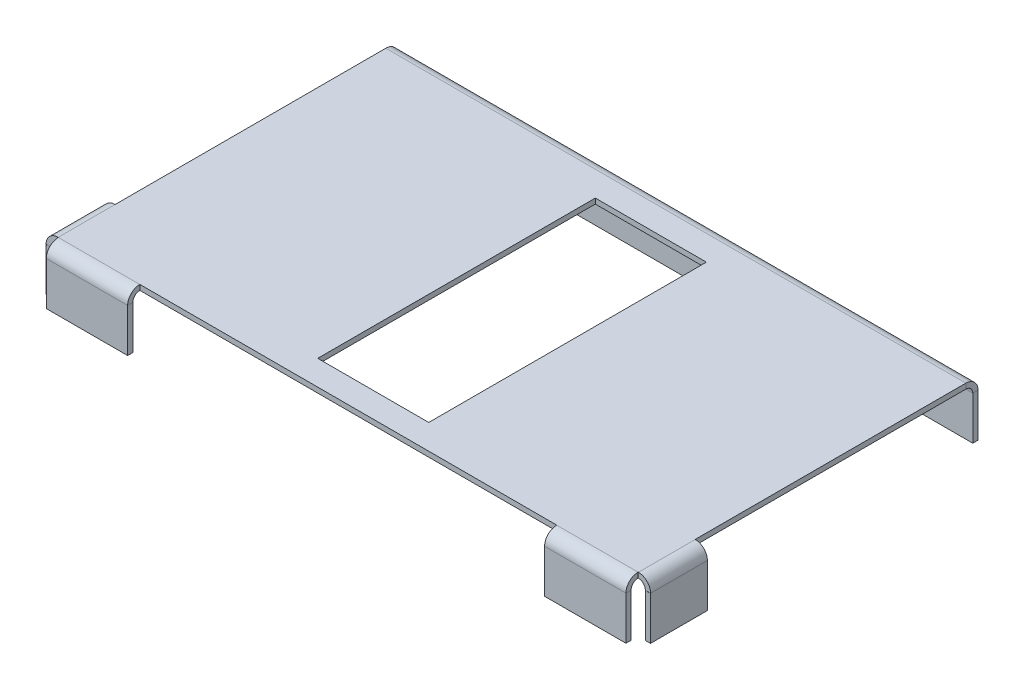
from build123d import *

# Parameters (mm, degrees)
SKETCH1_W                    = 271.78
SKETCH1_H                    = 156.21
BASE_FLANGE1_DEPTH           = 2.38125
EDGE_FLANGE1_STRIP_W         = 15.875
EDGE_FLANGE1_STRIP_H         = 2.38125
EDGE_FLANGE1_STRIP_CUT_DEPTH = 271.78
EDGE_FLANGE1_DEPTH           = 271.78
EDGE_FLANGE2_STRIP_W         = 15.875
EDGE_FLANGE2_STRIP_H         = 2.38125
EDGE_FLANGE2_STRIP_CUT_DEPTH = 153.035
EDGE_FLANGE2_DEPTH           = 153.035
SKETCH14_W                   = 127
SKETCH14_H                   = 30.097595223
CUT_EXTRUDE1_DEPTH           = 5.588
EDGE_FLANGE3_STRIP_W         = 15.875
EDGE_FLANGE3_STRIP_H         = 2.38125
EDGE_FLANGE3_STRIP_CUT_DEPTH = 153.035
EDGE_FLANGE3_DEPTH           = 153.035
SKETCH18_W                   = 127
SKETCH18_H                   = 45.504454023
CUT_EXTRUDE2_DEPTH           = 5.588
CUT_EXTRUDE3_START           = -3.302
CUT_EXTRUDE3_DEPTH           = 5.68325
CUT_EXTRUDE4_START           = -3.302
CUT_EXTRUDE4_DEPTH           = 5.68325
EDGE_FLANGE4_STRIP_W         = 15.875
EDGE_FLANGE4_STRIP_H         = 2.38125
EDGE_FLANGE4_STRIP_CUT_DEPTH = 265.3665
EDGE_FLANGE4_DEPTH           = 265.3665
SKETCH24_W                   = 190.754
SKETCH24_H                   = 70.532416994
CUT_EXTRUDE5_DEPTH           = 5.588
SKETCH25_W                   = 50.8
SKETCH25_H                   = 127
CUT_EXTRUDE6_DEPTH           = 2.54


# Read off the part's stored shape, not the designer's step: Cut-Extrude3, Cut-Extrude4
# Sheet-metal steps are written as plain solids
with BuildPart() as part:
    # Sketch1 → Base-Flange1 (new body)
    with BuildSketch(Plane(origin=(0, 0, 0), x_dir=(1, 0, 0), z_dir=(0, 1, 0))):
        Rectangle(SKETCH1_W, SKETCH1_H)
    extrude(amount=-BASE_FLANGE1_DEPTH)

    # Edge-Flange1 strip (across the edge) → Edge-Flange1 strip cut (cut)
    with BuildSketch(Plane(origin=(135.89, -2.38125, 78.105), x_dir=(0, 0, -1), z_dir=(-1, 0, 0))):
        with Locations((-4.7625, -1.190625)):
            Rectangle(EDGE_FLANGE1_STRIP_W, EDGE_FLANGE1_STRIP_H)
    extrude(amount=EDGE_FLANGE1_STRIP_CUT_DEPTH, mode=Mode.SUBTRACT)

    # Edge-Flange1 section (across the edge) → Edge-Flange1 (add)
    with BuildSketch(Plane(origin=(135.89, -2.38125, 78.105), x_dir=(0, 0, -1), z_dir=(-1, 0, 0))):
        with BuildLine():
            Line((-2.38125, 3.175), (-2.38125, 23.01875))
            Line((-2.38125, 23.01875), (0, 23.01875))
            Line((0, 23.01875), (0, 3.175))
            ThreePointArc((0, 3.175), (0.92993597, 0.92993597), (3.175, 0))
            Line((3.175, 0), (3.175, -2.38125))
            ThreePointArc((3.175, -2.38125), (-0.753862053, -0.753862053), (-2.38125, 3.175))
        make_face()
    extrude(amount=EDGE_FLANGE1_DEPTH)

    # Edge-Flange2 strip (across the edge) → Edge-Flange2 strip cut (cut)
    with BuildSketch(Plane(origin=(135.89, -2.38125, -78.105), x_dir=(-1, 0, 0), z_dir=(0, 0, 1))):
        with Locations((-4.7625, -1.190625)):
            Rectangle(EDGE_FLANGE2_STRIP_W, EDGE_FLANGE2_STRIP_H)
    extrude(amount=EDGE_FLANGE2_STRIP_CUT_DEPTH, mode=Mode.SUBTRACT)

    # Edge-Flange2 section (across the edge) → Edge-Flange2 (add)
    with BuildSketch(Plane(origin=(135.89, -2.38125, -78.105), x_dir=(-1, 0, 0), z_dir=(0, 0, 1))):
        with BuildLine():
            Line((-2.38125, 3.175), (-2.38125, 23.01875))
            Line((-2.38125, 23.01875), (0, 23.01875))
            Line((0, 23.01875), (0, 3.175))
            ThreePointArc((0, 3.175), (0.92993597, 0.92993597), (3.175, 0))
            Line((3.175, 0), (3.175, -2.38125))
            ThreePointArc((3.175, -2.38125), (-0.753862053, -0.753862053), (-2.38125, 3.175))
        make_face()
    extrude(amount=EDGE_FLANGE2_DEPTH)

    # Sketch14 → Cut-Extrude1 (cut)
    with BuildSketch(Plane(origin=(138.27125, 0, 0), x_dir=(0, 0, -1), z_dir=(1, 0, 0))):
        with Locations((14.605, -10.351202389)):
            Rectangle(SKETCH14_W, SKETCH14_H)
    extrude(amount=-CUT_EXTRUDE1_DEPTH, mode=Mode.SUBTRACT)

    # Edge-Flange3 strip (across the edge) → Edge-Flange3 strip cut (cut)
    with BuildSketch(Plane(origin=(-135.89, -2.38125, 74.93), x_dir=(1, 0, 0), z_dir=(0, 0, -1))):
        with Locations((-4.7625, -1.190625)):
            Rectangle(EDGE_FLANGE3_STRIP_W, EDGE_FLANGE3_STRIP_H)
    extrude(amount=EDGE_FLANGE3_STRIP_CUT_DEPTH, mode=Mode.SUBTRACT)

    # Edge-Flange3 section (across the edge) → Edge-Flange3 (add)
    with BuildSketch(Plane(origin=(-135.89, -2.38125, 74.93), x_dir=(1, 0, 0), z_dir=(0, 0, -1))):
        with BuildLine():
            Line((-2.38125, 3.175), (-2.38125, 23.01875))
            Line((-2.38125, 23.01875), (0, 23.01875))
            Line((0, 23.01875), (0, 3.175))
            ThreePointArc((0, 3.175), (0.92993597, 0.92993597), (3.175, 0))
            Line((3.175, 0), (3.175, -2.38125))
            ThreePointArc((3.175, -2.38125), (-0.753862053, -0.753862053), (-2.38125, 3.175))
        make_face()
    extrude(amount=EDGE_FLANGE3_DEPTH)

    # Sketch18 → Cut-Extrude2 (cut)
    with BuildSketch(Plane.ZY.offset(138.27125)):
        with Locations((-14.605, -2.647772988)):
            Rectangle(SKETCH18_W, SKETCH18_H)
    extrude(amount=-CUT_EXTRUDE2_DEPTH, mode=Mode.SUBTRACT)

    # Cut-Extrude3 outline → Cut-Extrude3 (cut)
    with BuildSketch(Plane.ZY.offset(135.89).offset(CUT_EXTRUDE3_START)):
        with BuildLine():
            Line((74.93, 0), (74.89825, 0))
            Line((74.89825, 0), (74.89825, -5.55625))
            Line((74.89825, -5.55625), (74.93, -5.55625))
            Line((74.93, -5.55625), (74.93, -2.38125))
            ThreePointArc((74.93, -2.38125), (77.17506403, -3.31118597), (78.105, -5.55625))
            Line((78.105, -5.55625), (78.105, -25.4))
            Line((78.105, -25.4), (80.48625, -25.4))
            Line((80.48625, -25.4), (80.48625, -5.55625))
            ThreePointArc((80.48625, -5.55625), (78.858862053, -1.627387947), (74.93, 0))
        make_face()
    extrude(amount=CUT_EXTRUDE3_DEPTH, mode=Mode.SUBTRACT)

    # Cut-Extrude4 outline → Cut-Extrude4 (cut)
    with BuildSketch(Plane(origin=(135.89, 0, 0), x_dir=(0, 0, -1), z_dir=(1, 0, 0)).offset(CUT_EXTRUDE4_START)):
        with BuildLine():
            Line((-74.89825, 0), (-74.93, 0))
            ThreePointArc((-74.93, 0), (-78.858862053, -1.627387947), (-80.48625, -5.55625))
            Line((-80.48625, -5.55625), (-80.48625, -25.4))
            Line((-80.48625, -25.4), (-78.105, -25.4))
            Line((-78.105, -25.4), (-78.105, -5.55625))
            ThreePointArc((-78.105, -5.55625), (-77.17506403, -3.31118597), (-74.93, -2.38125))
            Line((-74.93, -2.38125), (-74.93, -5.55625))
            Line((-74.93, -5.55625), (-74.89825, -5.55625))
            Line((-74.89825, -5.55625), (-74.89825, 0))
        make_face()
    extrude(amount=CUT_EXTRUDE4_DEPTH, mode=Mode.SUBTRACT)

    # Edge-Flange4 strip (across the edge) → Edge-Flange4 strip cut (cut)
    with BuildSketch(Plane(origin=(-132.68325, -2.38125, -78.105), x_dir=(0, 0, 1), z_dir=(1, 0, 0))):
        with Locations((-4.7625, -1.190625)):
            Rectangle(EDGE_FLANGE4_STRIP_W, EDGE_FLANGE4_STRIP_H)
    extrude(amount=EDGE_FLANGE4_STRIP_CUT_DEPTH, mode=Mode.SUBTRACT)

    # Edge-Flange4 section (across the edge) → Edge-Flange4 (add)
    with BuildSketch(Plane(origin=(-132.68325, -2.38125, -78.105), x_dir=(0, 0, 1), z_dir=(1, 0, 0))):
        with BuildLine():
            Line((-2.38125, 3.175), (-2.38125, 23.01875))
            Line((-2.38125, 23.01875), (0, 23.01875))
            Line((0, 23.01875), (0, 3.175))
            ThreePointArc((0, 3.175), (0.92993597, 0.92993597), (3.175, 0))
            Line((3.175, 0), (3.175, -2.38125))
            ThreePointArc((3.175, -2.38125), (-0.753862053, -0.753862053), (-2.38125, 3.175))
        make_face()
    extrude(amount=EDGE_FLANGE4_DEPTH)

    # Sketch24 → Cut-Extrude5 (cut)
    with BuildSketch(Plane.XY.offset(80.48625)):
        Rectangle(SKETCH24_W, SKETCH24_H)
    extrude(amount=-CUT_EXTRUDE5_DEPTH, mode=Mode.SUBTRACT)

    # Sketch25 → Cut-Extrude6 (cut)
    with BuildSketch(Plane(origin=(0, 0, 0), x_dir=(1, 0, 0), z_dir=(0, 1, 0))):
        Rectangle(SKETCH25_W, SKETCH25_H)
    extrude(amount=-CUT_EXTRUDE6_DEPTH, mode=Mode.SUBTRACT)


solid = part.part
